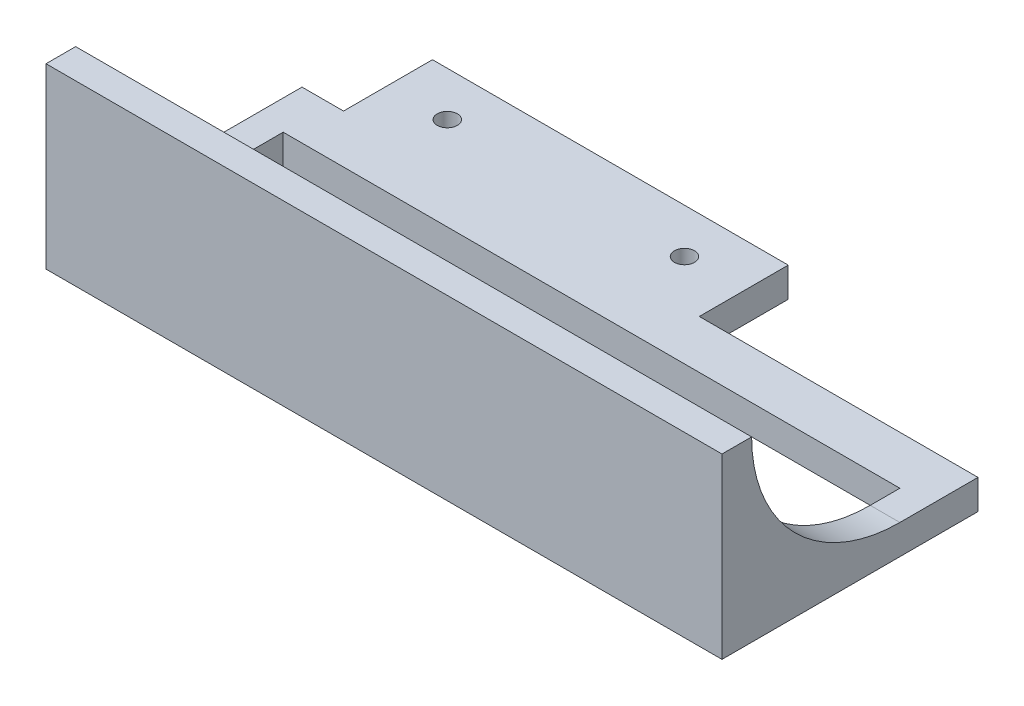
from build123d import *

# Parameters (mm, degrees)
SKETCH1_W           = 104
SKETCH1_H           = 30
SKETCH1_R           = 1.7
BOSS_EXTRUDE1_DEPTH = 5
BOSS_EXTRUDE2_DEPTH = 25
FILLET1_R           = 25


with BuildPart() as part:
    # Sketch1 → Boss-Extrude1 (new body)
    with BuildSketch(Plane(origin=(0, 0, 0), x_dir=(1, 0, 0), z_dir=(0, 1, 0))):
        Polygon((67, -8.528010066), (7, -8.528010066), (7, -23.528010066), (0, -23.528010066), (0, -66.703010066), (114, -66.703010066), (114, -23.528010066), (67, -23.528010066), align=None)
        with Locations((57, -46.703010066)):
            Rectangle(SKETCH1_W, SKETCH1_H, mode=Mode.SUBTRACT)
        with Locations(Location((17, -16.028010066, 0), (0, 0, 270))):
            Circle(SKETCH1_R, mode=Mode.SUBTRACT)
        with Locations(Location((57, -16.028010066, 0), (0, 0, 270))):
            Circle(SKETCH1_R, mode=Mode.SUBTRACT)
    extrude(amount=BOSS_EXTRUDE1_DEPTH)

    # Sketch2 → Boss-Extrude2 (add)
    with BuildSketch(Plane(origin=(0, 5, 0), x_dir=(1, 0, 0), z_dir=(0, 1, 0))):
        Polygon((5, -61.703010066), (0, -61.703010066), (0, -66.703010066), (114, -66.703010066), (114, -61.703010066), align=None)
    extrude(amount=BOSS_EXTRUDE2_DEPTH)

    # Fillet1
    fillet1_edges = [part.edges().sort_by_distance(p)[0] for p in [
        (2.5, 5, 61.703010066),
        (111.5, 5, 61.703010066),
    ]]
    fillet(fillet1_edges, radius=FILLET1_R - 0.0001)  # a hair under: the kernel refuses the full size


solid = part.part
